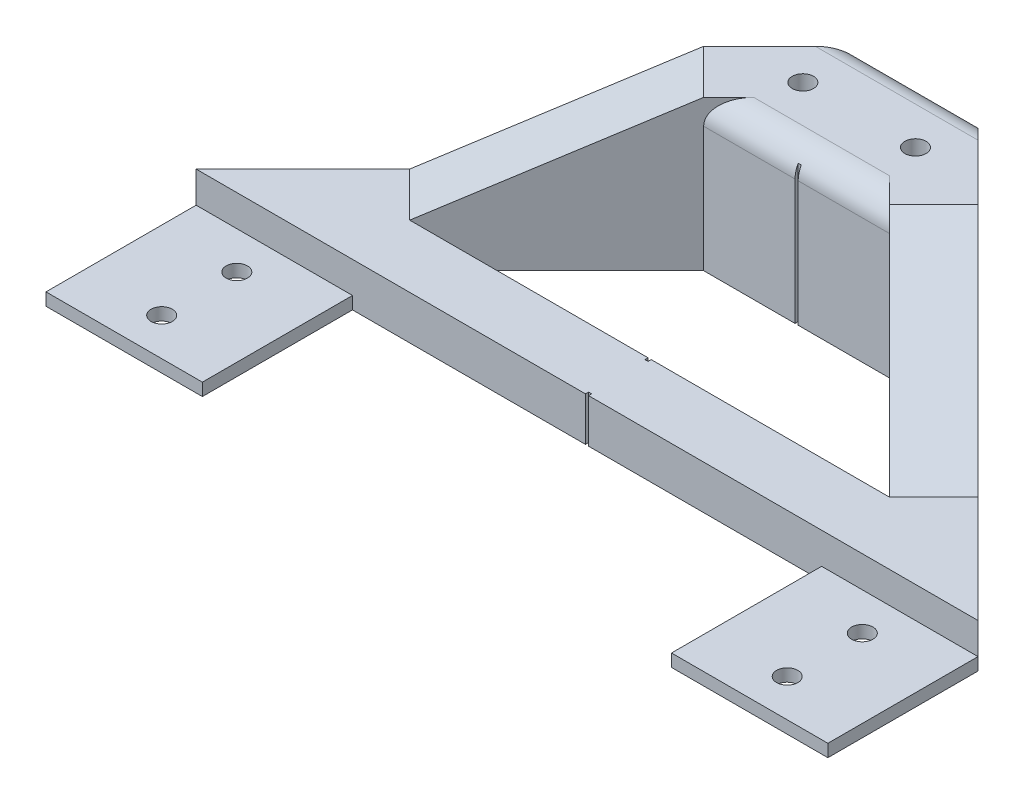
from build123d import *

# Parameters (mm, degrees)
BEARING_MOUNTS_W             = 25
BEARING_MOUNTS_H             = 24
BEARING_MOUNT_PLATES_DEPTH   = 2
BEARING_MOUNT_PLATES_2_DEPTH = 2
BRIDGE_DEPTH                 = 7
M3_BEARING_HOLES_R           = 1.7
BEARING_MOUNT_HOLES_DEPTH    = 2
SKETCH7_W                    = 0.5
SKETCH7_H                    = 7
ALIGNMENT_HELPER_1_DEPTH     = 0.5
SKETCH24_W                   = 0.5
SKETCH24_H                   = 1
ALIGNMENT_HELPER_1B_DEPTH    = 10
BELT_MOUNT_DEPTH             = 17
SKETCH8_R                    = 1.7
BELT_MOUNT_HOLES_DEPTH       = 139.069728761
ANGLE_LEFT_DEPTH             = 17
ANGLE_LEFT_CUT_DEPTH         = 30
ANGLE_RIGHT_DEPTH            = 17
ANGLE_RIGHT_CUT_DEPTH        = 30
SKETCH23_W                   = 0.5
SKETCH23_H                   = 1
ALIGNMENT_HELPER_2_DEPTH     = 139.069728761
FILLET5_R                    = 4
FILLET2_R                    = 4
SKETCH25_W                   = 0.5
SKETCH25_H                   = 1
ALIGNMENT_HELPER_2B_DEPTH    = 139.069728761


with BuildPart() as part:
    # Bearing Mounts → Bearing Mount Plates (new body)
    with BuildSketch(Plane(origin=(0, 0, 0), x_dir=(1, 0, 0), z_dir=(0, 1, 0))):
        with Locations((12.5, -12)):
            Rectangle(BEARING_MOUNTS_W, BEARING_MOUNTS_H)
    extrude(amount=BEARING_MOUNT_PLATES_DEPTH)


with BuildPart() as body_2:
    # Bearing Mounts → Bearing Mount Plates 2 (new body)
    with BuildSketch(Plane(origin=(0, 0, 0), x_dir=(1, 0, 0), z_dir=(0, 1, 0))):
        with Locations((112.5, -12)):
            Rectangle(BEARING_MOUNTS_W, BEARING_MOUNTS_H)
    extrude(amount=BEARING_MOUNT_PLATES_2_DEPTH)


with BuildPart() as body_3:
    # Triangle → Bridge (new body)
    with BuildSketch(Plane(origin=(0, 0, 0), x_dir=(1, 0, 0), z_dir=(0, 1, 0))):
        Polygon((0, 0), (125, 0), (71.5, 53.5), (53.5, 53.5), align=None)
        Polygon((24.142135624, 10), (100.857864376, 10), (77.357864376, 33.5), (47.642135624, 33.5), align=None, mode=Mode.SUBTRACT)
    extrude(amount=BRIDGE_DEPTH)

    # Sketch7 → Alignment helper 1 (cut)
    with BuildSketch(Plane.XY):
        with Locations((62.5, 3.5)):
            Rectangle(SKETCH7_W, SKETCH7_H)
    extrude(amount=-ALIGNMENT_HELPER_1_DEPTH, mode=Mode.SUBTRACT)

    # Sketch24 → Alignment helper 1b (cut)
    with BuildSketch(Plane.XZ):
        with Locations((62.5, -10)):
            Rectangle(SKETCH24_W, SKETCH24_H)
    extrude(amount=-ALIGNMENT_HELPER_1B_DEPTH, mode=Mode.SUBTRACT)

    # Sketch9 → Belt Mount (add)
    with BuildSketch(Plane(origin=(0, 7, 0), x_dir=(1, 0, 0), z_dir=(0, 1, 0))):
        Polygon((33.5, 33.5), (53.5, 53.5), (71.5, 53.5), (91.5, 33.5), align=None)
    extrude(amount=BELT_MOUNT_DEPTH)

    # Sketch8 → Belt Mount Holes (cut, through all)
    with BuildSketch(Plane(origin=(0, 0, 0), x_dir=(1, 0, 0), z_dir=(0, 1, 0))):
        with Locations(Location((53.5, 43.5, 0), (0, 0, 270))):
            Circle(SKETCH8_R)
        with Locations(Location((71.5, 43.5, 0), (0, 0, 270))):
            Circle(SKETCH8_R)
    extrude(amount=BELT_MOUNT_HOLES_DEPTH, mode=Mode.SUBTRACT)

    # Sketch14 → Angle Left (add)
    with BuildSketch(Plane(origin=(0, 7, 0), x_dir=(1, 0, 0), z_dir=(0, 1, 0))):
        Polygon((24.142135624, 10), (47.642135624, 33.5), (33.5, 33.5), (10, 10), align=None)
    extrude(amount=ANGLE_LEFT_DEPTH)

    # Sketch17 → Angle Left Cut (cut)
    with BuildSketch(Plane(origin=(7.071067812, 0, 7.071067812), x_dir=(0.7071067811865369, 0, -0.7071067811865581), z_dir=(0.7071067811865581, 0, 0.7071067811865369))):
        Polygon((57.376154339, 24), (24.142135624, 7), (10, 7), (10, 24), (24.142135624, 24), align=None)
    extrude(amount=-ANGLE_LEFT_CUT_DEPTH, mode=Mode.SUBTRACT)

    # Sketch20 → Angle Right (add)
    with BuildSketch(Plane(origin=(0, 7, 0), x_dir=(1, 0, 0), z_dir=(0, 1, 0))):
        Polygon((100.857864376, 10), (115, 10), (91.5, 33.5), (77.357864376, 33.5), align=None)
    extrude(amount=ANGLE_RIGHT_DEPTH)

    # Sketch21 → Angle Right Cut (cut)
    with BuildSketch(Plane(origin=(55.428932188, 0, -55.428932188), x_dir=(0.7071067811865511, 0, 0.707106781186544), z_dir=(-0.707106781186544, 0, 0.7071067811865511))):
        Polygon((31.012193309, 24), (64.246212025, 7), (78.388347648, 7), (78.388347648, 24), (64.246212025, 24), align=None)
    extrude(amount=-ANGLE_RIGHT_CUT_DEPTH, mode=Mode.SUBTRACT)

    # Sketch23 → Alignment helper 2 (cut, through all)
    with BuildSketch(Plane(origin=(0, 0, 0), x_dir=(1, 0, 0), z_dir=(0, 1, 0))):
        with Locations((62.5, 53.5)):
            Rectangle(SKETCH23_W, SKETCH23_H)
    extrude(amount=ALIGNMENT_HELPER_2_DEPTH, mode=Mode.SUBTRACT)

    # Fillet5
    # the kernel refuses this fillet: 4 mm, written as the material it takes off along each edge
    with BuildSketch(Plane(origin=(87.357864376, 24, -33.5), x_dir=(0, -1, 0), z_dir=(-1, 0, 0))) as fillet5_piece_1_section:
        with BuildLine():
            CenterArc((FILLET5_R, -FILLET5_R), FILLET5_R, 90, 90)
            Line((0, -FILLET5_R), (0, 0))
            Line((0, 0), (FILLET5_R, 0))
        make_face()
    fillet5_piece_1 = extrude(amount=49.715728753, mode=Mode.PRIVATE)
    fillet5_piece_1 = split(fillet5_piece_1, bisect_by=Plane(origin=(55.497209135, 23.062933131, -41.355073512), z_dir=(0.7071067811865583, 0, 0.7071067811865369)), keep=Keep.TOP, mode=Mode.PRIVATE)
    fillet5_piece_1 = split(fillet5_piece_1, bisect_by=Plane(origin=(69.502790865, 23.062933131, -41.355073512), z_dir=(-0.7071067811865436, 0, 0.7071067811865515)), keep=Keep.TOP, mode=Mode.PRIVATE)
    add(fillet5_piece_1, mode=Mode.SUBTRACT)

    # Fillet2
    # the kernel refuses this fillet: 4 mm, written as the material it takes off along each edge
    with BuildSketch(Plane(origin=(43.5, 24, -53.5), x_dir=(0, -1, 0), z_dir=(1, 0, 0)), Plane(origin=(52.75, 24, -53.5), x_dir=(0, -1, 0), z_dir=(1, 0, 0))) as fillet2_piece_1:
        with BuildLine():
            CenterArc((FILLET2_R, -FILLET2_R), FILLET2_R, 90, 90)
            Line((0, -FILLET2_R), (0, 0))
            Line((0, 0), (FILLET2_R, 0))
        make_face()
    extrude(amount=28.75, mode=Mode.SUBTRACT)

    # Sketch25 → Alignment helper 2b (cut, through all)
    with BuildSketch(Plane.XZ):
        with Locations((62.5, -33.5)):
            Rectangle(SKETCH25_W, SKETCH25_H)
    extrude(amount=-ALIGNMENT_HELPER_2B_DEPTH, mode=Mode.SUBTRACT)


with BuildPart() as bearing_mount_holes_tool:
    # M3 Bearing Holes → Bearing Mount Holes (new body)
    with BuildSketch(Plane.XZ):
        with Locations(Location((112.5, 6, 0), (0, 0, 270))):
            Circle(M3_BEARING_HOLES_R)
        with Locations(Location((112.5, 18, 0), (0, 0, 270))):
            Circle(M3_BEARING_HOLES_R)
        with Locations(Location((12.5, 6, 0), (0, 0, 270))):
            Circle(M3_BEARING_HOLES_R)
        with Locations(Location((12.5, 18, 0), (0, 0, 270))):
            Circle(M3_BEARING_HOLES_R)
    extrude(amount=-BEARING_MOUNT_HOLES_DEPTH)


with BuildPart() as part_1:
    add(part.part)

    # Bearing Mount Holes: cut by bearing_mount_holes_tool
    add(bearing_mount_holes_tool.part, mode=Mode.SUBTRACT)


with BuildPart() as body_2_1:
    add(body_2.part)

    # Bearing Mount Holes: cut by bearing_mount_holes_tool
    add(bearing_mount_holes_tool.part, mode=Mode.SUBTRACT)


solid = Compound([body_3.part, part_1.part, body_2_1.part])
